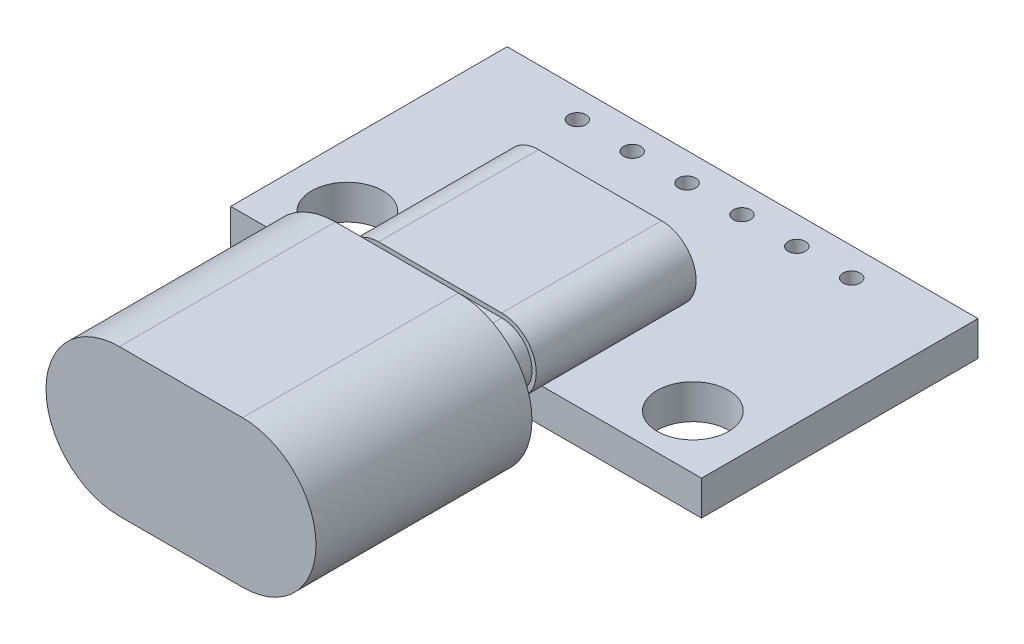
from build123d import *

# Parameters (mm, degrees)
SKETCH1_W           = 21.8
SKETCH1_H           = 12.8
BOSS_EXTRUDE1_DEPTH = 1.6
SKETCH2_R           = 1.65
CUT_EXTRUDE1_DEPTH  = 1.6
BOSS_EXTRUDE2_DEPTH = 7.4
BOSS_EXTRUDE3_DEPTH = 2
BOSS_EXTRUDE4_DEPTH = 10
CUT_EXTRUDE2_DEPTH  = 6
SKETCH7_W           = 5.8
SKETCH7_H           = 0.7
BOSS_EXTRUDE5_DEPTH = 5
SKETCH8_R           = 0.4
CUT_EXTRUDE3_DEPTH  = 23.977597786


# Read off the part's stored shape, not the designer's step: Split1
with BuildPart() as part:
    # Sketch1 → Boss-Extrude1 (new body)
    with BuildSketch(Plane(origin=(0, 0, 0), x_dir=(1, 0, 0), z_dir=(0, 1, 0))):
        Rectangle(SKETCH1_W, SKETCH1_H)
    extrude(amount=BOSS_EXTRUDE1_DEPTH)

    # Sketch2 → Cut-Extrude1 (cut)
    with BuildSketch(Plane(origin=(0, 1.6, 0), x_dir=(1, 0, 0), z_dir=(0, 1, 0))):
        with Locations(Location((-8, -3.9, 0), (0, 0, 270))):
            Circle(SKETCH2_R)
        with Locations(Location((8, -3.9, 0), (0, 0, 270))):
            Circle(SKETCH2_R)
    extrude(amount=-CUT_EXTRUDE1_DEPTH, mode=Mode.SUBTRACT)

    # Sketch3 → Boss-Extrude2 (add)
    with BuildSketch(Plane.XY.offset(7.6)):
        with BuildLine():
            Line((-2.85, 4.8), (2.85, 4.8))
            ThreePointArc((2.85, 4.8), (4.45, 3.2), (2.85, 1.6))
            Line((2.85, 1.6), (-2.85, 1.6))
            ThreePointArc((-2.85, 1.6), (-4.45, 3.2), (-2.85, 4.8))
        make_face()
    extrude(amount=-BOSS_EXTRUDE2_DEPTH)

    # Sketch4 → Boss-Extrude3 (add)
    with BuildSketch(Plane.XY.offset(7.6)):
        with BuildLine():
            Line((-2.85, 1.8), (2.85, 1.8))
            ThreePointArc((2.85, 1.8), (4.25, 3.2), (2.85, 4.6))
            Line((2.85, 4.6), (-2.85, 4.6))
            ThreePointArc((-2.85, 4.6), (-4.25, 3.2), (-2.85, 1.8))
        make_face()
    extrude(amount=BOSS_EXTRUDE3_DEPTH)

    # Sketch5 → Boss-Extrude4 (add)
    with BuildSketch(Plane.XY.offset(9.6)):
        with BuildLine():
            Line((-2.85, -0.2), (2.85, -0.2))
            ThreePointArc((2.85, -0.2), (6.25, 3.2), (2.85, 6.6))
            Line((2.85, 6.6), (-2.85, 6.6))
            ThreePointArc((-2.85, 6.6), (-6.25, 3.2), (-2.85, -0.2))
        make_face()
    extrude(amount=BOSS_EXTRUDE4_DEPTH)


with BuildPart() as body_2:
    # Split1: the piece on the far side of the plane
    add(part.part)
    split(bisect_by=Plane.XY.offset(7.6), keep=Keep.BOTTOM)

    # Sketch6 → Cut-Extrude2 (cut)
    with BuildSketch(Plane.XY.offset(7.6)):
        with BuildLine():
            Line((-2.85, 1.9), (2.85, 1.9))
            ThreePointArc((2.85, 1.9), (4.15, 3.2), (2.85, 4.5))
            Line((2.85, 4.5), (-2.85, 4.5))
            ThreePointArc((-2.85, 4.5), (-4.15, 3.2), (-2.85, 1.9))
        make_face()
    extrude(amount=-CUT_EXTRUDE2_DEPTH, mode=Mode.SUBTRACT)

    # Sketch7 → Boss-Extrude5 (add)
    with BuildSketch(Plane.XY.offset(1.6)):
        with Locations((0, 3.2)):
            Rectangle(SKETCH7_W, SKETCH7_H)
    extrude(amount=BOSS_EXTRUDE5_DEPTH)

    # Sketch8 → Cut-Extrude3 (cut, through all)
    with BuildSketch(Plane(origin=(0, 1.6, 0), x_dir=(1, 0, 0), z_dir=(0, 1, 0))):
        with Locations(Location((-1.27, 5.1, 0), (0, 0, 270))):
            Circle(SKETCH8_R)
        with Locations(Location((-3.81, 5.1, 0), (0, 0, 270))):
            Circle(SKETCH8_R)
        with Locations(Location((-6.35, 5.1, 0), (0, 0, 270))):
            Circle(SKETCH8_R)
        with Locations(Location((1.27, 5.1, 0), (0, 0, 90))):
            Circle(SKETCH8_R)
        with Locations(Location((3.81, 5.1, 0), (0, 0, 90))):
            Circle(SKETCH8_R)
        with Locations(Location((6.35, 5.1, 0), (0, 0, 90))):
            Circle(SKETCH8_R)
    extrude(amount=-CUT_EXTRUDE3_DEPTH, mode=Mode.SUBTRACT)


with BuildPart() as part_1:
    add(part.part)

    # Split1
    split(bisect_by=Plane.XY.offset(7.6), keep=Keep.TOP)


solid = Compound([body_2.part, part_1.part])
